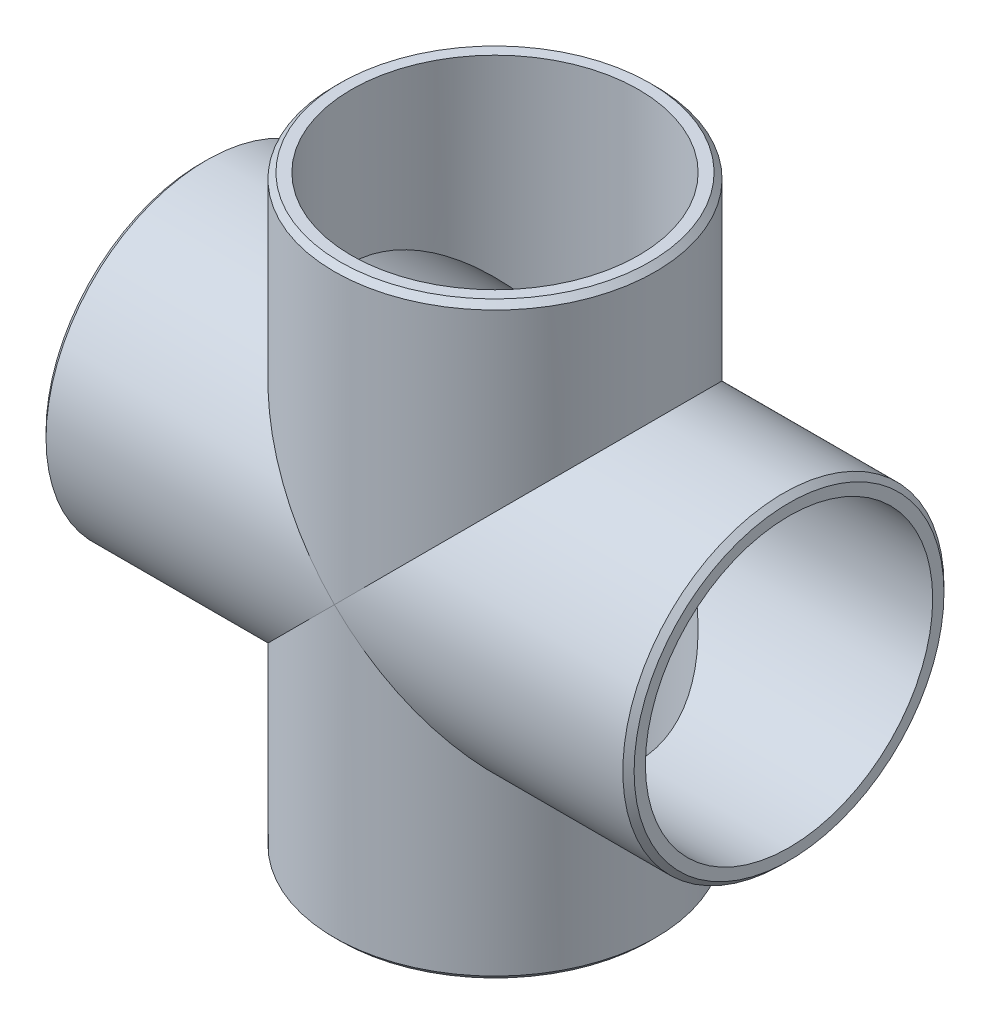
from build123d import *

# Parameters (mm, degrees)
RUNROUTE_R             = 57.15
RUNEXTRUDE_DEPTH       = 104.648
OUTLETROUTE_R          = 57.15
OUTLETEXTRUDE_DEPTH    = 104.648
CROSSSHELL_START       = -104.648
CROSSSHELL_OUTLINE_R   = 51.1302
CROSSSHELL_DEPTH       = 209.296
CROSSSHELL_2_OUTLINE_R = 51.1302
CROSSSHELL_2_DEPTH     = 209.296
CROSSCHAMFER_SIZE      = 2.0066


with BuildPart() as part:
    # RunRoute → RunExtrude (new body)
    with BuildSketch(Plane(origin=(0, 0, 0), x_dir=(0, 0, -1), z_dir=(1, 0, 0))):
        Circle(RUNROUTE_R)
    runextrude = extrude(amount=RUNEXTRUDE_DEPTH)

    # RunExtrudeMirror: RunExtrude across plane
    add(runextrude.mirror(Plane(origin=(0, 0, 0), x_dir=(0, 0, 1), z_dir=(1, 0, 0))))

    # OutletRoute → OutletExtrude (add)
    with BuildSketch(Plane(origin=(0, 0, 0), x_dir=(1, 0, 0), z_dir=(0, 1, 0))):
        with Locations(Location((0, 0, 0), (0, 0, 270))):
            Circle(OUTLETROUTE_R)
    outletextrude = extrude(amount=OUTLETEXTRUDE_DEPTH)

    # OutletExtrudeMirror: OutletExtrude across plane
    add(outletextrude.mirror(Plane.ZX))

    # CrossShell: read off the stored shape, not the designer's step
    # CrossShell outline → CrossShell (cut)
    with BuildSketch(Plane.YZ.offset(CROSSSHELL_START)):
        Circle(CROSSSHELL_OUTLINE_R)
    extrude(amount=CROSSSHELL_DEPTH, mode=Mode.SUBTRACT)

    # CrossShell 2 outline → CrossShell 2 (cut)
    with BuildSketch(Plane(origin=(0, 0, 0), x_dir=(1, 0, 0), z_dir=(0, 1, 0)).offset(CROSSSHELL_START)):
        Circle(CROSSSHELL_2_OUTLINE_R)
    extrude(amount=CROSSSHELL_2_DEPTH, mode=Mode.SUBTRACT)

    # CrossChamfer
    crosschamfer_edges = [part.edges().sort_by_distance(p)[0] for p in [
        (0, -104.648, -57.15),
        (104.648, 0, 57.15),
        (-104.648, 0, 57.15),
        (0, 104.648, -57.15),
    ]]
    chamfer(crosschamfer_edges, length=CROSSCHAMFER_SIZE)


solid = part.part
